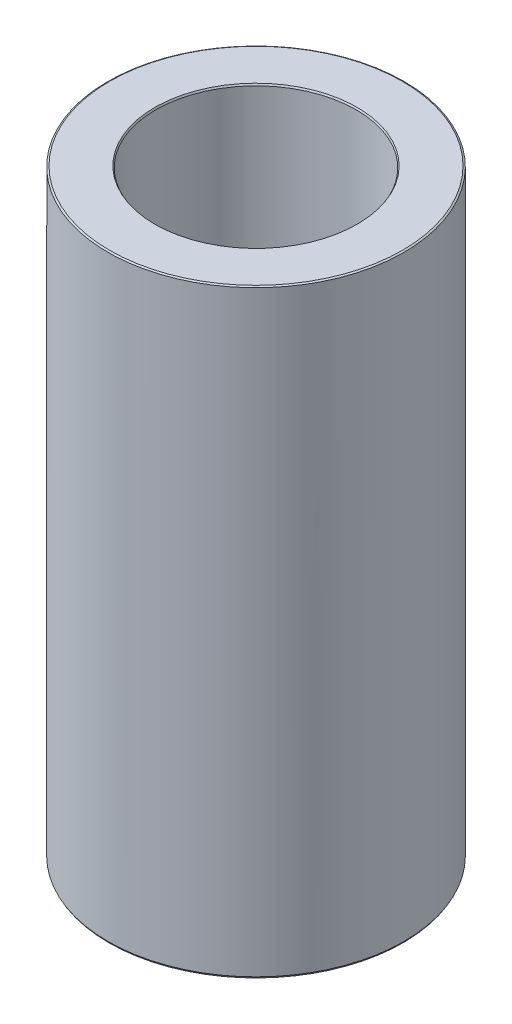
from build123d import *
from OCP.BRepFilletAPI import BRepFilletAPI_MakeChamfer

# Parameters (mm, degrees)
SKETCH1_R           = 40
BOSS_EXTRUDE1_DEPTH = 161.945501475
SKETCH2_R           = 27.100627021
CUT_EXTRUDE1_DEPTH  = 172.541089678
CHAMFER1_SIZE       = 0.246362989
CHAMFER1_SIZE2      = 0.443442958


with BuildPart() as part:
    # Sketch1 → Boss-Extrude1 (new body)
    with BuildSketch(Plane(origin=(0, 0, 0), x_dir=(1, 0, 0), z_dir=(0, 1, 0))):
        Circle(SKETCH1_R)
    extrude(amount=BOSS_EXTRUDE1_DEPTH)

    # Sketch2 → Cut-Extrude1 (cut, through all)
    with BuildSketch(Plane(origin=(0, 0, 0), x_dir=(1, 0, 0), z_dir=(0, 1, 0))):
        Circle(SKETCH2_R)
    extrude(amount=CUT_EXTRUDE1_DEPTH, mode=Mode.SUBTRACT)

    # Chamfer1: one chamfer whose edges measure the first distance from different faces: ONE call of the kernel's chamfer builder (chamfer() names one face for all edges)
    chamfer1_edges_1 = [part.edges().sort_by_distance(p)[0] for p in [
        (-27.100627021, 161.945501475, 0),
    ]]
    chamfer1_side_1 = [part.faces().sort_by_distance(p)[0] for p in [
        (-38.86862915, 161.945501475, 0),
    ]]
    chamfer1_edges_2 = [part.edges().sort_by_distance(p)[0] for p in [
        (-27.100627021, 0, 0),
    ]]
    chamfer1_side_2 = [part.faces().sort_by_distance(p)[0] for p in [
        (-27.100627021, 80.972750737, 0),
    ]]
    chamfer1_edges_3 = [part.edges().sort_by_distance(p)[0] for p in [
        (-40, 0, 0),
    ]]
    chamfer1_side_3 = [part.faces().sort_by_distance(p)[0] for p in [
        (-38.86862915, 0, 0),
    ]]
    chamfer1_edges_4 = [part.edges().sort_by_distance(p)[0] for p in [
        (-40, 161.945501475, 0),
    ]]
    chamfer1_side_4 = [part.faces().sort_by_distance(p)[0] for p in [
        (-40, 80.972750737, 0),
    ]]
    chamfer1 = BRepFilletAPI_MakeChamfer(part.part.solid().wrapped)
    for e in chamfer1_edges_1:
        chamfer1.Add(CHAMFER1_SIZE, CHAMFER1_SIZE2, e.wrapped, chamfer1_side_1[0].wrapped)  # the first distance lies on this face
    for e in chamfer1_edges_2:
        chamfer1.Add(CHAMFER1_SIZE, CHAMFER1_SIZE2, e.wrapped, chamfer1_side_2[0].wrapped)  # the first distance lies on this face
    for e in chamfer1_edges_3:
        chamfer1.Add(CHAMFER1_SIZE, CHAMFER1_SIZE2, e.wrapped, chamfer1_side_3[0].wrapped)  # the first distance lies on this face
    for e in chamfer1_edges_4:
        chamfer1.Add(CHAMFER1_SIZE, CHAMFER1_SIZE2, e.wrapped, chamfer1_side_4[0].wrapped)  # the first distance lies on this face
    add(Compound.cast(chamfer1.Shape()), mode=Mode.REPLACE)


solid = part.part
